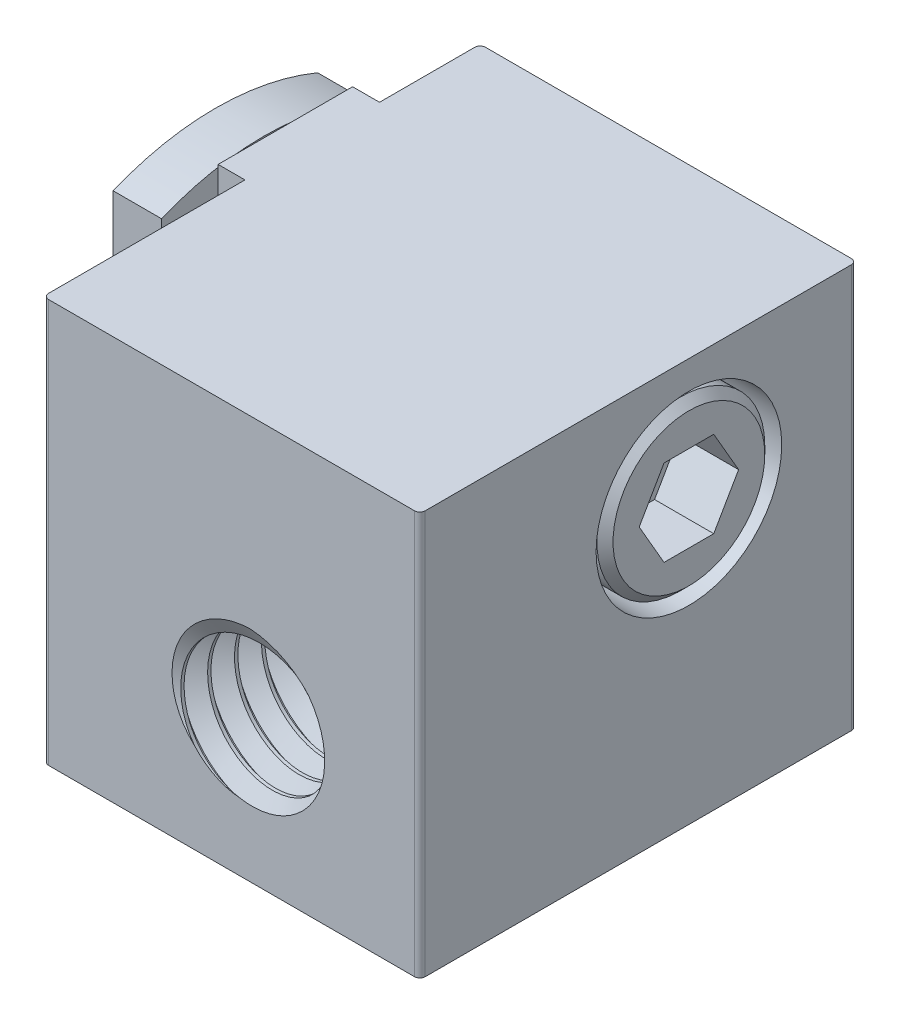
from build123d import *
from build123d.topology import SkipClean

# Parameters (mm, degrees)
MAIN_BODY_DEPTH        = 9.525
MAIN_BODY_DEPTH_BACK   = 9.525
TAP_HOLE_DEPTH         = 19.593441929
TAP_HOLE_DEPTH_BACK    = 19.593441929
SKETCH6_R              = 3.175
RAIL_START             = -7.874
RAIL_GUIDE_DEPTH       = 2.286
SKETCH11_R             = 3.06324
SKETCH11_R_2           = 2.5527
BOSS_EXTRUDE2_DEPTH    = 0.73152
THRU_HOLE_DEPTH        = 19.593441929
THRU_HOLE_DEPTH_BACK   = 19.593441929
SKETCH7_R              = 2.5527
COUNTERBORE_START      = 12.192
SKETCH8_R              = 4.3815
COUNTERBORE_DEPTH      = 5.334
SCREW_SHAFT_DEPTH      = 9.398
SCREW_SHAFT_DEPTH_BACK = 12.192
SKETCH12_R             = 2.5527
SKETCH13_R             = 3.9624
SCREW_HEAD_DEPTH       = 2.794
CUT_EXTRUDE1_DEPTH     = 2.794
FILLET1_R              = 0.254
CHAMFER4_SIZE          = 0.381
CUT_SWEEP4_PITCH       = 1.27


with BuildPart() as part:
    # Sketch5 → Main Body (new, two sides: drawn at the far end of the back side and taken through both)
    with BuildSketch(Plane(origin=(0, 0, 0), x_dir=(1, 0, 0), z_dir=(0, 1, 0)).offset(-MAIN_BODY_DEPTH_BACK)):
        Polygon((12.192, -10.3124), (12.192, 10.3124), (-5.588, 10.3124), (-5.588, 5.5626), (-6.858, 5.5626), (-6.858, -0.7874), (-5.588, -0.7874), (-5.588, -10.3124), align=None)
    extrude(amount=MAIN_BODY_DEPTH + MAIN_BODY_DEPTH_BACK)

    # Sketch6 → Tap Hole (cut, two sides: drawn at the far end of the back side and taken through both)
    with BuildSketch(Plane.XY.offset(-TAP_HOLE_DEPTH_BACK)):
        with Locations((3.937, -3.175)):
            Circle(SKETCH6_R)
    extrude(amount=TAP_HOLE_DEPTH + TAP_HOLE_DEPTH_BACK, mode=Mode.SUBTRACT)


with BuildPart() as body_2:
    # Sketch10 → Rail Guide (new body)
    with BuildSketch(Plane(origin=(0, 0, 0), x_dir=(0, 0, -1), z_dir=(1, 0, 0)).offset(RAIL_START)):
        with BuildLine():
            Line((7.2136, 7.62), (7.2136, -6.35))
            ThreePointArc((7.2136, -6.35), (2.3876, -7.313088157), (-2.4384, -6.35))
            Line((-2.4384, -6.35), (-2.4384, 7.62))
            ThreePointArc((-2.4384, 7.62), (2.3876, 8.583088157), (7.2136, 7.62))
        make_face()
    extrude(amount=-RAIL_GUIDE_DEPTH)

    # Sketch11 → Boss-Extrude2 (add)
    with BuildSketch(Plane.ZY.offset(10.16)):
        with Locations(Location((-2.3876, 3.81, 0), (0, 0, 180))):
            Circle(SKETCH11_R)
        with Locations((-2.3876, 3.81)):
            Circle(SKETCH11_R_2, mode=Mode.SUBTRACT)
    extrude(amount=BOSS_EXTRUDE2_DEPTH)


with BuildPart() as thru_hole_tool:
    # Sketch7 → Thru Hole (new, two sides: drawn at the far end of the back side and taken through both)
    with SkipClean():  # the faces are left unmerged after this step: merging them gives an invalid solid
        with BuildSketch(Plane(origin=(0, 0, 0), x_dir=(0, 0, -1), z_dir=(1, 0, 0)).offset(-THRU_HOLE_DEPTH_BACK)):
            with Locations((2.3876, 3.81)):
                Circle(SKETCH7_R)
        extrude(amount=THRU_HOLE_DEPTH + THRU_HOLE_DEPTH_BACK)


with BuildPart() as part_1:
    with SkipClean():  # the faces are left unmerged after this step: merging them gives an invalid solid
        add(part.part)

        # Thru Hole: cut by thru_hole_tool
        add(thru_hole_tool.part, mode=Mode.SUBTRACT)

    # Sketch8 → Counterbore (cut)
    with BuildSketch(Plane(origin=(0, 0, 0), x_dir=(0, 0, -1), z_dir=(1, 0, 0)).offset(COUNTERBORE_START)):
        with Locations((2.3876, 3.81)):
            Circle(SKETCH8_R)
    extrude(amount=-COUNTERBORE_DEPTH, mode=Mode.SUBTRACT)

    # Fillet1
    fillet1_edges = [part_1.edges().sort_by_distance(p)[0] for p in [
        (-5.588, 0, 10.3124),
        (-5.588, 0, -10.3124),
        (12.192, 0, -10.3124),
        (12.192, 0, 10.3124),
    ]]
    fillet(fillet1_edges, radius=FILLET1_R)

    # Cut-Sweep4: arcs per turn and ends read off the stored shape
    # Cut-Sweep4: the profile of Sketch15 screwed along a right-hand helix through 18.24 turns, 8 arcs to a turn; built about Z, then put on its axis
    cut_sweep4_z = Axis((0, 0, 0), (0, 0, 1))
    cut_sweep4_corners = [(3.999889197, 0, -1.905), (3.106259234, 0, -2.4209375), (3.106259234, 0, -1.2303125), (3.999889197, 0, -1.74625)]
    with BuildLine(mode=Mode.PRIVATE) as cut_sweep4_profile:
        Line(cut_sweep4_corners[0], cut_sweep4_corners[1])
        Line(cut_sweep4_corners[1], cut_sweep4_corners[2])
        Line(cut_sweep4_corners[2], cut_sweep4_corners[3])
        Line(cut_sweep4_corners[3], cut_sweep4_corners[0])
    cut_sweep4_cap = Face(cut_sweep4_profile.wire())
    cut_sweep4_turn_angles = [0, 22.5, 45, 67.5, 90, 112.5, 135, 157.5, 180, 202.5, 225, 247.5, 270, 292.5, 315, 337.5, 360]
    cut_sweep4_turn_weights = [1, 0.9238795325112867, 1, 0.9238795325112867, 1, 0.9238795325112867, 1, 0.9238795325112867, 1, 0.9238795325112867, 1, 0.9238795325112867, 1, 0.9238795325112867, 1, 0.9238795325112867, 1]
    cut_sweep4_turn_rails = [Edge.make_bspline([Vector(p[0], p[1], 0).rotate(cut_sweep4_z, cut_sweep4_turn_angles[k]) / cut_sweep4_turn_weights[k] + Vector(0, 0, p[2] + CUT_SWEEP4_PITCH * cut_sweep4_turn_angles[k] / 360) for k in range(17)], [0, 0, 0, 1, 1, 2, 2, 3, 3, 4, 4, 5, 5, 6, 6, 7, 7, 8, 8, 8], 2, cut_sweep4_turn_weights) for p in cut_sweep4_corners]
    cut_sweep4_turn_sides = [Face.make_surface_from_curves(cut_sweep4_turn_rails[p[0]], cut_sweep4_turn_rails[p[1]]) for p in [(0, 1), (1, 2), (2, 3), (3, 0)]]
    cut_sweep4_last_angles = [6480, 6502.5, 6525, 6545.7, 6566.4]
    cut_sweep4_last_weights = [1, 0.9238795325112867, 1, 0.9354440308298685, 1]
    cut_sweep4_last_rails = [Edge.make_bspline([Vector(p[0], p[1], 0).rotate(cut_sweep4_z, cut_sweep4_last_angles[k]) / cut_sweep4_last_weights[k] + Vector(0, 0, p[2] + CUT_SWEEP4_PITCH * cut_sweep4_last_angles[k] / 360) for k in range(5)], [0, 0, 0, 1, 1, 2, 2, 2], 2, cut_sweep4_last_weights) for p in cut_sweep4_corners]
    cut_sweep4_last_sides = [Face.make_surface_from_curves(cut_sweep4_last_rails[p[0]], cut_sweep4_last_rails[p[1]]) for p in [(0, 1), (1, 2), (2, 3), (3, 0)]]
    cut_sweep4 = Plane(origin=(3.937, -3.175, -10.3124), x_dir=(-1, 0, 0), z_dir=(0, 0, 1)) * Solid(Shell([*[p.moved(Location((0, 0, CUT_SWEEP4_PITCH * i))) for i in range(18) for p in cut_sweep4_turn_sides], *cut_sweep4_last_sides, cut_sweep4_cap, cut_sweep4_cap.rotate(cut_sweep4_z, 6566.4).moved(Location((0, 0, CUT_SWEEP4_PITCH * 6566.4 / 360)))]))
    add(cut_sweep4, mode=Mode.SUBTRACT)


with BuildPart() as body_2_1:
    with SkipClean():  # the faces are left unmerged after this step: merging them gives an invalid solid
        add(body_2.part)

        # Thru Hole: cut by thru_hole_tool
        add(thru_hole_tool.part, mode=Mode.SUBTRACT)


with BuildPart() as body_3:
    # Sketch12 → Screw Shaft (new, two sides: drawn at the far end of the back side and taken through both)
    with BuildSketch(Plane(origin=(0, 0, 0), x_dir=(0, 0, -1), z_dir=(1, 0, 0)).offset(-SCREW_SHAFT_DEPTH_BACK)):
        with Locations((2.3876, 3.81)):
            Circle(SKETCH12_R)
    extrude(amount=SCREW_SHAFT_DEPTH + SCREW_SHAFT_DEPTH_BACK)


with BuildPart() as body_4:
    # Sketch13 → Screw Head (new body)
    with BuildSketch(Plane(origin=(9.398, 0, 0), x_dir=(0, 0, -1), z_dir=(1, 0, 0))):
        with Locations((2.3876, 3.81)):
            Circle(SKETCH13_R)
    extrude(amount=SCREW_HEAD_DEPTH)

    # Sketch14 → Cut-Extrude1 (cut)
    with BuildSketch(Plane(origin=(12.192, 0, 0), x_dir=(0, 0, -1), z_dir=(1, 0, 0))):
        Polygon((4.733951494, 3.81), (3.560775747, 5.842), (1.214424253, 5.842), (0.041248506, 3.81), (1.214424253, 1.778), (3.560775747, 1.778), align=None)
    extrude(amount=-CUT_EXTRUDE1_DEPTH, mode=Mode.SUBTRACT)

    # Combine3: union body 3
    add(body_3.part)

    # Chamfer4
    chamfer4_edges = [body_4.edges().sort_by_distance(p)[0] for p in [
        (-12.192, 3.81, 0.1651),
        (12.192, 3.81, 1.5748),
    ]]
    chamfer(chamfer4_edges, length=CHAMFER4_SIZE)


solid = Compound([part_1.part, body_2_1.part, body_4.part])
